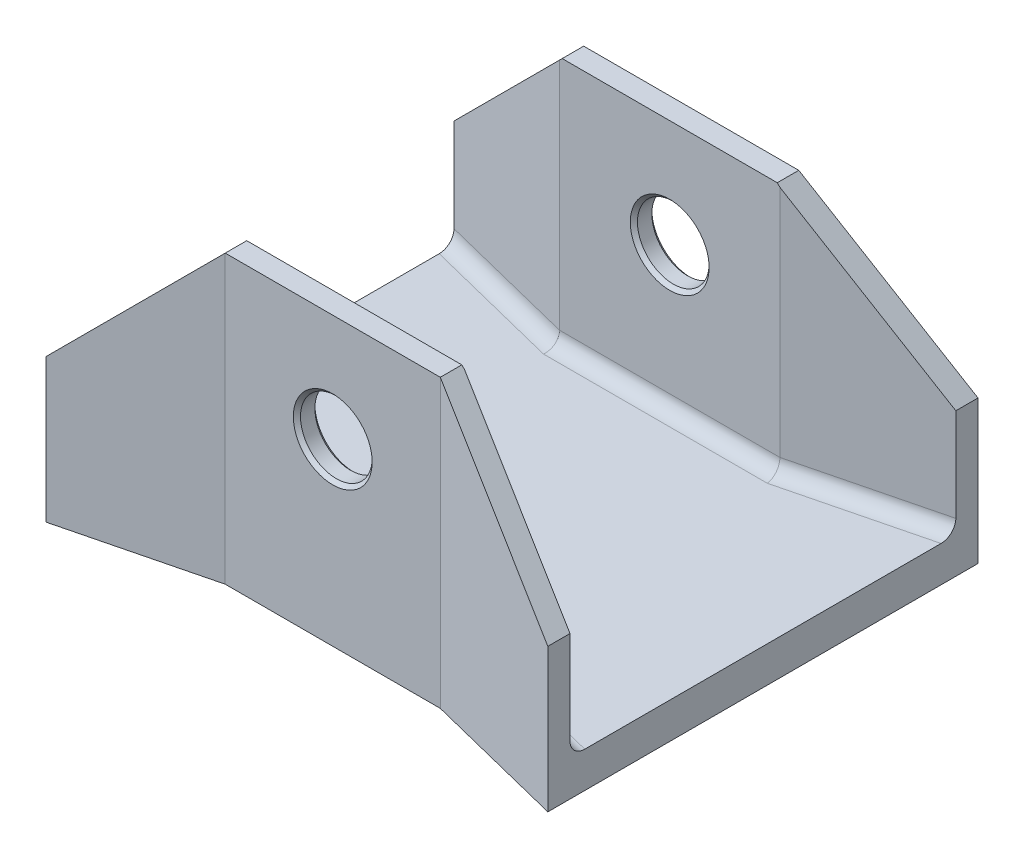
from build123d import *

# Parameters (mm, degrees)
BOSS_EXTRUDE1_DEPTH = 40
CUT_EXTRUDE1_DEPTH  = 35
CHAMFER1_SIZE       = 20
SKETCH4_R           = 5
CUT_EXTRUDE2_DEPTH  = 77.485292704
FILLET1_R           = 2
CHAMFER2_SIZE       = 0.5


with BuildPart() as part:
    # Sketch1 → Boss-Extrude1 (new body)
    with BuildSketch(Plane(origin=(0, 0, 0), x_dir=(1, 0, 0), z_dir=(0, 1, 0))):
        Polygon((-35, -30), (-35, 30), (-15, 25), (15, 25), (35, 30), (35, -30), (15, -25), (-15, -25), align=None)
    extrude(amount=BOSS_EXTRUDE1_DEPTH)

    # Sketch2 → Cut-Extrude1 (cut)
    with BuildSketch(Plane(origin=(0, 40, 0), x_dir=(1, 0, 0), z_dir=(0, 1, 0))):
        Polygon((-15.369316877, 22), (-49.922572363, 30.638313872), (-49.922572363, -30.638313872), (-15.369316877, -22), (15.369316877, -22), (46.296501907, -29.731796258), (46.296501907, 29.731796258), (15.369316877, 22), align=None)
    extrude(amount=-CUT_EXTRUDE1_DEPTH, mode=Mode.SUBTRACT)

    # Chamfer1
    # the kernel refuses this chamfer: 20 mm, written as the material it takes off along each edge
    with BuildSketch(Plane(origin=(35, 40, -24.525988979), x_dir=(-0.9996219169112968, 0.027495876610586317, 0), z_dir=(0, 0, 1)), Plane(origin=(35, 40, -81.433659759), x_dir=(-0.9996219169112968, 0.027495876610586317, 0), z_dir=(0, 0, 1))) as chamfer1_piece_1:
        Polygon((CHAMFER1_SIZE * 0.999621916911, CHAMFER1_SIZE * 0.0274958766106), (-CHAMFER1_SIZE * 0.0274958766106, CHAMFER1_SIZE * 0.999621916911), (0, 0), align=None)
    extrude(amount=105.959648738, mode=Mode.SUBTRACT)
    with BuildSketch(Plane(origin=(-35, 40, 24.525988979), x_dir=(-0.027495876610586317, -0.9996219169112968, 0), z_dir=(0, 0, -1)), Plane(origin=(-35, 40, 81.433659759), x_dir=(-0.027495876610586317, -0.9996219169112968, 0), z_dir=(0, 0, -1))) as chamfer1_piece_2:
        Polygon((CHAMFER1_SIZE * 0.999621916911, -CHAMFER1_SIZE * 0.0274958766106), (-CHAMFER1_SIZE * 0.0274958766106, -CHAMFER1_SIZE * 0.999621916911), (0, 0), align=None)
    extrude(amount=105.959648738, mode=Mode.SUBTRACT)

    # Sketch4 → Cut-Extrude2 (cut, through all)
    with BuildSketch(Plane.XY.offset(25)):
        with Locations((0, 25)):
            Circle(SKETCH4_R)
    extrude(amount=-CUT_EXTRUDE2_DEPTH, mode=Mode.SUBTRACT)

    # Fillet1
    fillet1_edges = [part.edges().sort_by_distance(p)[0] for p in [
        (25.184658438, 5, -24.45383539),
        (25.184658438, 5, 24.45383539),
        (-25.184658438, 5, 24.45383539),
        (-25.184658438, 5, -24.45383539),
        (0, 5, -22),
        (0, 5, 22),
    ]]
    fillet(fillet1_edges, radius=FILLET1_R)

    # Chamfer2
    chamfer2_edges = [part.edges().sort_by_distance(p)[0] for p in [
        (-5, 25, -22),
        (-5, 25, -25),
        (-5, 25, 22),
        (-5, 25, 25),
    ]]
    chamfer(chamfer2_edges, length=CHAMFER2_SIZE)


solid = part.part
